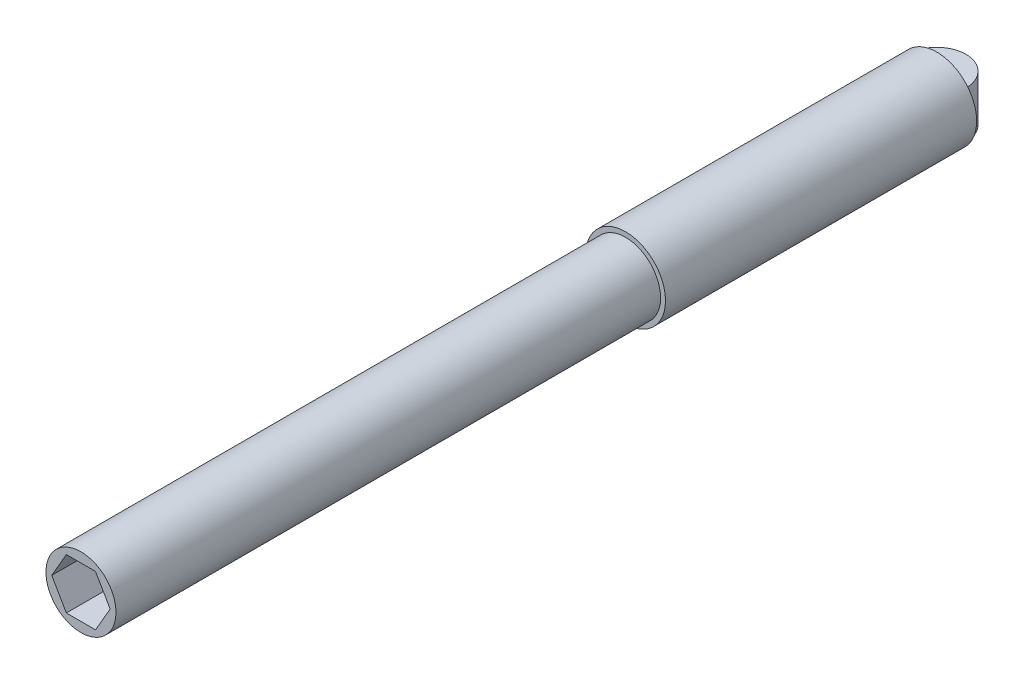
from build123d import *

# Parameters (mm, degrees)
SKETCH1_R                = 1.025
BOSS_EXTRUDE1_DEPTH      = 12
CUT_EXTRUDE1_DEPTH       = 7
BOSS_EXTRUDE2_START      = 4
SKETCH3_R                = 1.025
BOSS_EXTRUDE2_DEPTH      = 4
SKETCH6_R                = 1.025
BOSS_EXTRUDE5_DEPTH      = 7
BOSS_EXTRUDE6_START      = 2
SKETCH7_R                = 1.025
BOSS_EXTRUDE6_DEPTH      = 2
BOSS_EXTRUDE8_DEPTH      = 0.6
BOSS_EXTRUDE8_DEPTH_BACK = 0.6
CUT_EXTRUDE3_START       = -17
SKETCH9_R                = 1.025
CUT_EXTRUDE3_DEPTH       = 17
SKETCH10_R               = 0.9
BOSS_EXTRUDE12_DEPTH     = 14


with BuildPart() as part:
    # Sketch1 → Boss-Extrude1 (new body)
    with BuildSketch(Plane.XY):
        Circle(SKETCH1_R)
    extrude(amount=BOSS_EXTRUDE1_DEPTH)

    # Sketch2 → Cut-Extrude1 (cut)
    with BuildSketch(Plane.XY.offset(12)):
        Polygon((0.433012702, -0.75), (0.866025404, 0), (0.433012702, 0.75), (-0.433012702, 0.75), (-0.866025404, 0), (-0.433012702, -0.75), align=None)
    extrude(amount=-CUT_EXTRUDE1_DEPTH, mode=Mode.SUBTRACT)

    # Sketch3 → Boss-Extrude2 (add)
    with BuildSketch(Plane(origin=(0, 0, 0), x_dir=(-1, 0, 0), z_dir=(0, 0, -1)).offset(BOSS_EXTRUDE2_START)):
        Circle(SKETCH3_R)
    extrude(amount=-BOSS_EXTRUDE2_DEPTH)

    # Sketch6 → Boss-Extrude5 (add)
    with BuildSketch(Plane.XY.offset(12)):
        Circle(SKETCH6_R)
        Polygon((0.866025404, 0), (0.433012702, 0.75), (-0.433012702, 0.75), (-0.866025404, 0), (-0.433012702, -0.75), (0.433012702, -0.75), align=None, mode=Mode.SUBTRACT)
    extrude(amount=BOSS_EXTRUDE5_DEPTH)

    # Sketch7 → Boss-Extrude6 (add)
    with BuildSketch(Plane(origin=(0, 0, -4), x_dir=(-1, 0, 0), z_dir=(0, 0, -1)).offset(BOSS_EXTRUDE6_START)):
        Circle(SKETCH7_R)
    extrude(amount=-BOSS_EXTRUDE6_DEPTH)

    # Sketch8 → Boss-Extrude8 (add, two sides: drawn at the far end of the back side and taken through both)
    with BuildSketch(Plane(origin=(0, 0, 0), x_dir=(1, 0, 0), z_dir=(0, 1, 0)).offset(-BOSS_EXTRUDE8_DEPTH_BACK)):
        with BuildLine():
            ThreePointArc((0.75, 6), (0, 6.75), (-0.75, 6))
            Line((-0.75, 6), (0.75, 6))
        make_face()
    extrude(amount=BOSS_EXTRUDE8_DEPTH + BOSS_EXTRUDE8_DEPTH_BACK)

    # Sketch9 → Cut-Extrude3 (cut)
    with BuildSketch(Plane.XY.offset(19).offset(CUT_EXTRUDE3_START)):
        Circle(SKETCH9_R)
    extrude(amount=CUT_EXTRUDE3_DEPTH, mode=Mode.SUBTRACT)

    # Sketch10 → Boss-Extrude12 (add)
    with BuildSketch(Plane.XY.offset(2)):
        Circle(SKETCH10_R)
        Polygon((0.375277675, 0.65), (0.75055535, 0), (0.375277675, -0.65), (-0.375277675, -0.65), (-0.75055535, 0), (-0.375277675, 0.65), align=None, mode=Mode.SUBTRACT)
    extrude(amount=BOSS_EXTRUDE12_DEPTH)


solid = part.part
